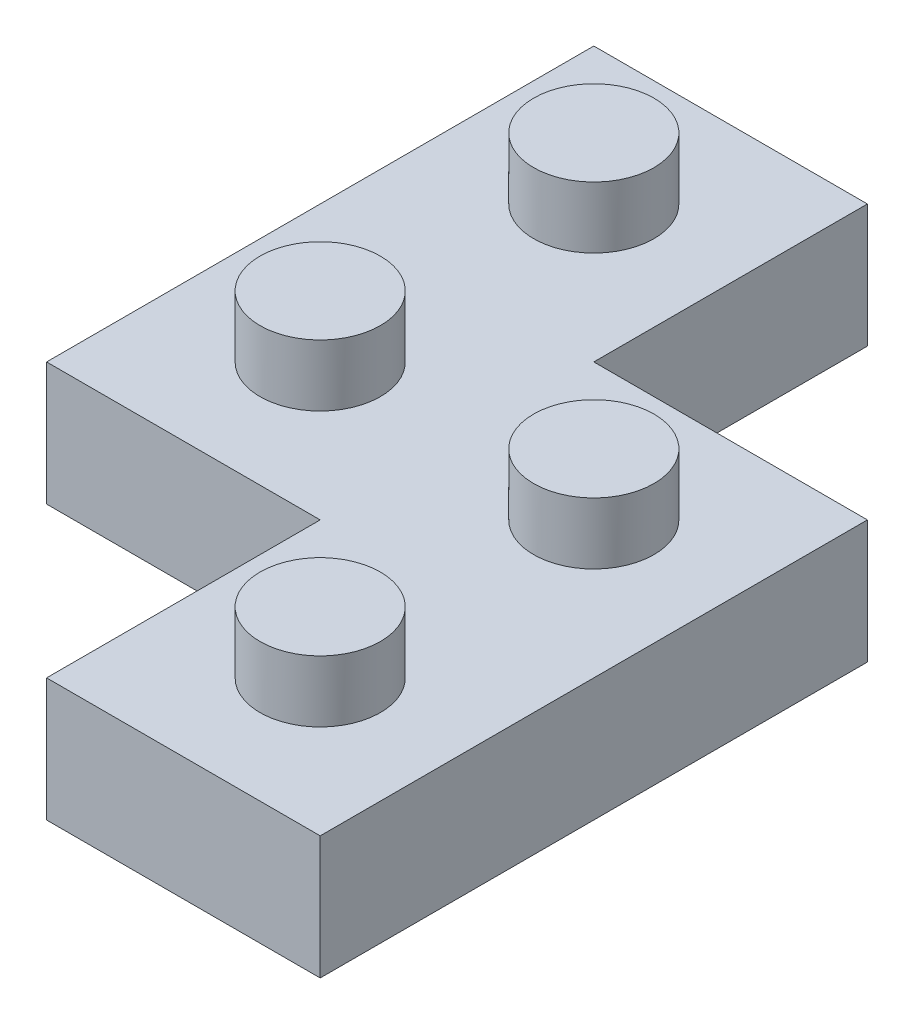
from build123d import *

# Parameters (mm, degrees)
BOSS_EXTRUDE1_DEPTH = 5.715
SKETCH2_R           = 2.794
BOSS_EXTRUDE3_DEPTH = 2.8575


with BuildPart() as part:
    # Sketch1 → Boss-Extrude1 (new body)
    with BuildSketch(Plane(origin=(0, 0, 0), x_dir=(1, 0, 0), z_dir=(0, 1, 0))):
        Polygon((-5.674598366, 20.311212687), (7.025401634, 20.311212687), (7.025401634, 7.611212687), (19.725401634, 7.611212687), (19.725401634, -17.788787313), (7.025401634, -17.788787313), (7.025401634, -5.088787313), (-5.674598366, -5.088787313), align=None)
    extrude(amount=BOSS_EXTRUDE1_DEPTH)

    # Sketch2 → Boss-Extrude3 (add)
    with BuildSketch(Plane(origin=(0, 5.715, 0), x_dir=(1, 0, 0), z_dir=(0, 1, 0))):
        with Locations((0.675401634, 1.261212687)):
            Circle(SKETCH2_R)
        with Locations((13.375401634, 1.261212687)):
            Circle(SKETCH2_R)
        with Locations((0.675401634, 13.961212687)):
            Circle(SKETCH2_R)
        with Locations((13.375401634, -11.438787313)):
            Circle(SKETCH2_R)
    extrude(amount=BOSS_EXTRUDE3_DEPTH)


solid = part.part
